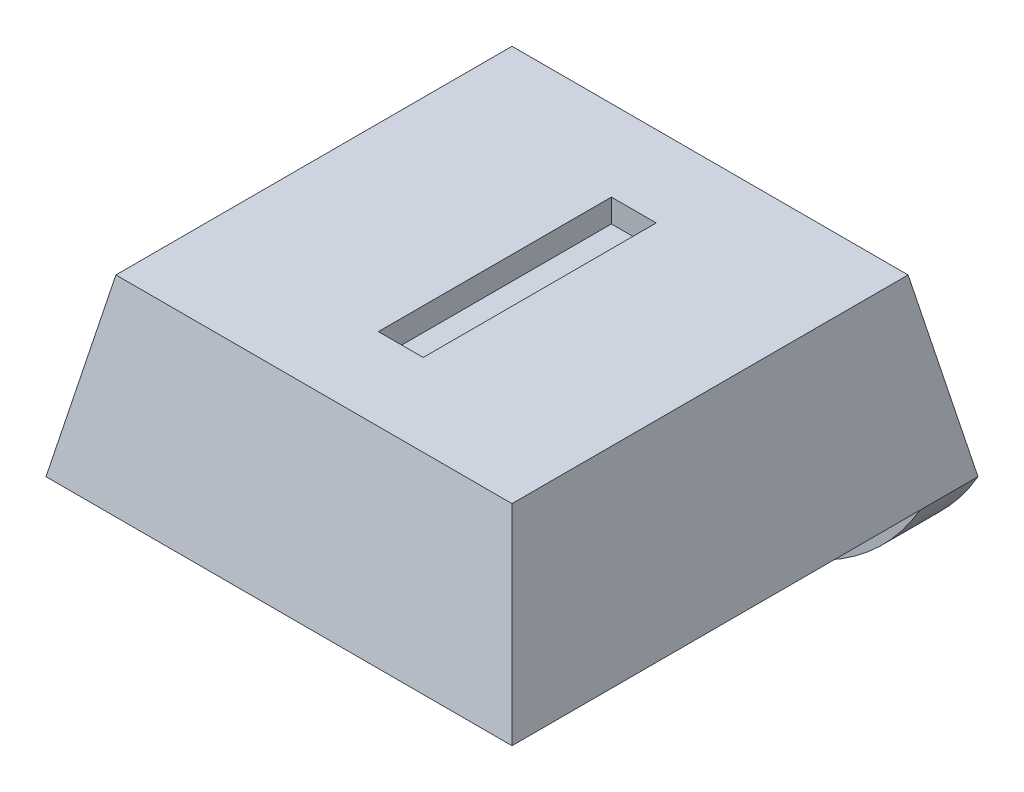
from build123d import *

# Parameters (mm, degrees)
SKETCH1_W               = 8
SKETCH1_H               = 8
BOSS_EXTRUDE1_DEPTH     = 3
CUT_EXTRUDE1_DEPTH      = 12.704699911
CUT_EXTRUDE1_DEPTH_BACK = 12.704699911
CUT_EXTRUDE2_DEPTH      = 11
SKETCH4_R               = 1.8
CUT_EXTRUDE3_DEPTH      = 0.8
SKETCH5_W               = 8
SKETCH5_H               = 1
BOSS_EXTRUDE2_DEPTH     = 2
FILLET1_R               = 4
SKETCH6_W               = 0.769230769
SKETCH6_H               = 4
CUT_EXTRUDE4_DEPTH      = 0.4


with BuildPart() as part:
    # Sketch1 → Boss-Extrude1 (new body)
    with BuildSketch(Plane(origin=(0, 0, 0), x_dir=(1, 0, 0), z_dir=(0, 1, 0))):
        with Locations((4, 4)):
            Rectangle(SKETCH1_W, SKETCH1_H)
    extrude(amount=BOSS_EXTRUDE1_DEPTH)

    # Sketch2 → Cut-Extrude1 (cut, two sides: drawn at the far end of the back side and taken through both)
    with BuildSketch(Plane.XY.offset(-CUT_EXTRUDE1_DEPTH_BACK)):
        Polygon((0, 0), (0.6, 3), (0, 3), align=None)
        Polygon((8, 0), (7.4, 3), (8, 3), align=None)
    extrude(amount=CUT_EXTRUDE1_DEPTH + CUT_EXTRUDE1_DEPTH_BACK, mode=Mode.SUBTRACT)

    # Sketch3 → Cut-Extrude2 (cut)
    with BuildSketch(Plane(origin=(0, 0, 0), x_dir=(0, 0, -1), z_dir=(1, 0, 0))):
        Polygon((0, 0), (0.6, 3), (0, 3), align=None)
        Polygon((8, 3), (7.4, 3), (8, 0), align=None)
    extrude(amount=CUT_EXTRUDE2_DEPTH, mode=Mode.SUBTRACT)

    # Sketch4 → Cut-Extrude3 (cut)
    with BuildSketch(Plane.XZ):
        with Locations(Location((4, -3.75, 0), (0, 0, 270))):
            Circle(SKETCH4_R)
    extrude(amount=-CUT_EXTRUDE3_DEPTH, mode=Mode.SUBTRACT)

    # Sketch5 → Boss-Extrude2 (add)
    with BuildSketch(Plane.XZ):
        with Locations((4, -7.5)):
            Rectangle(SKETCH5_W, SKETCH5_H)
    extrude(amount=BOSS_EXTRUDE2_DEPTH)

    # Fillet1
    # the kernel refuses this fillet: 4 mm, written as the material it takes off along each edge
    with BuildSketch(Plane(origin=(8, -2, -16.660254038), x_dir=(0, 1, 0), z_dir=(0, 0, 1)), Plane(origin=(0, -2, 1.660254038), x_dir=(0, 1, 0), z_dir=(0, 0, -1))) as fillet1_piece_1:
        with BuildLine():
            CenterArc((4, 3.464101615), FILLET1_R, 180, 60)
            Line((0, 3.464101615), (-0.08, 3.464101615))
            Line((-0.08, 3.464101615), (-0.08, 0))
            Line((-0.08, 0), (0, -0.08))
            ThreePointArc((0, -0.08), (1, -0.08), (1.96, -0.069282032))
            Line((1.96, -0.069282032), (2, 0))
        make_face()
    extrude(amount=18.320508076, mode=Mode.SUBTRACT)

    # Sketch6 → Cut-Extrude4 (cut)
    with BuildSketch(Plane(origin=(0, 3, 0), x_dir=(1, 0, 0), z_dir=(0, 1, 0))):
        with Locations((4.080454652, 4.010567225)):
            Rectangle(SKETCH6_W, SKETCH6_H)
    extrude(amount=-CUT_EXTRUDE4_DEPTH, mode=Mode.SUBTRACT)


solid = part.part
